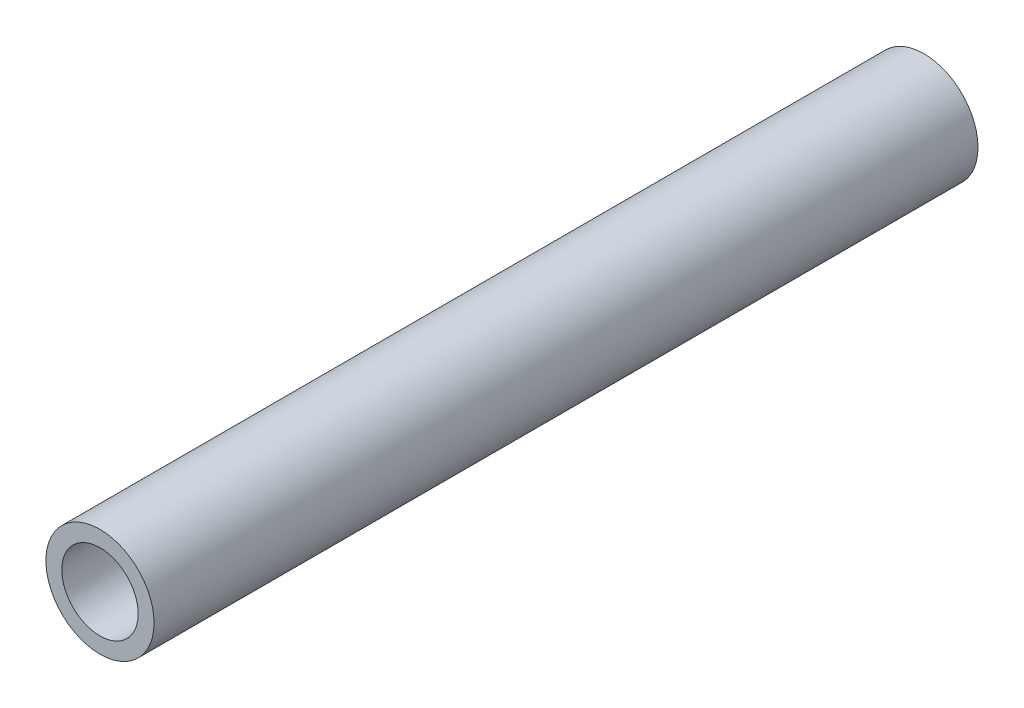
from build123d import *

# Parameters (mm, degrees)
SKETCH1_R           = 13.335
SKETCH1_R_2         = 9.4234
EXTRUDE_THIN1_DEPTH = 101.6


with BuildPart() as part:
    # Sketch1 → Extrude-Thin1 (new, symmetric)
    with BuildSketch(Plane.XY):
        Circle(SKETCH1_R)
        Circle(SKETCH1_R_2, mode=Mode.SUBTRACT)
    extrude(amount=EXTRUDE_THIN1_DEPTH, both=True)


solid = part.part
